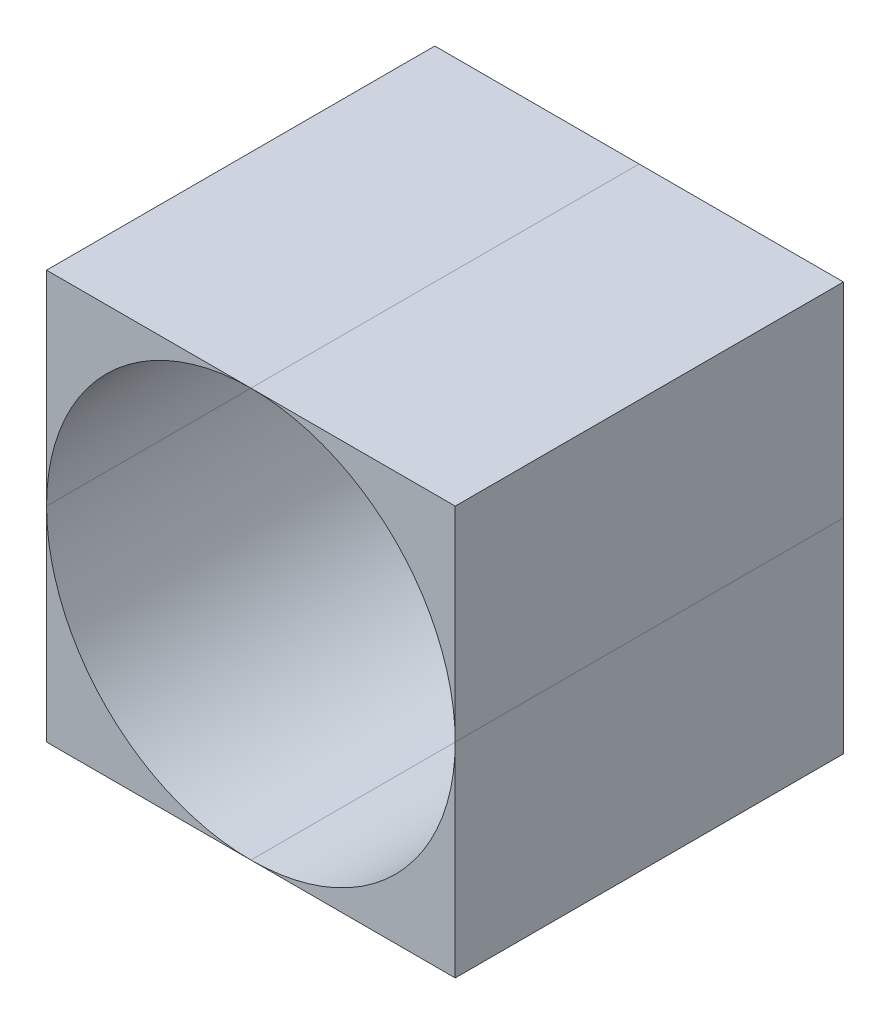
from build123d import *

# Parameters (mm, degrees)
BOSS_EXTRUDE1_DEPTH   = 9.5
BOSS_EXTRUDE1_2_DEPTH = 9.5
BOSS_EXTRUDE1_3_DEPTH = 9.5
BOSS_EXTRUDE1_4_DEPTH = 9.5


with BuildPart() as part:
    # Sketch1 → Boss-Extrude1 (new body)
    with BuildSketch(Plane.XY):
        with BuildLine():
            Line((-5, 0), (-5, -5))
            Line((-5, -5), (0, -5))
            ThreePointArc((0, -5), (-3.535533906, -3.535533906), (-5, 0))
        make_face()
    extrude(amount=BOSS_EXTRUDE1_DEPTH)


with BuildPart() as body_2:
    # Sketch1 → Boss-Extrude1 2 (new body)
    with BuildSketch(Plane.XY):
        with BuildLine():
            ThreePointArc((5, 0), (3.535533906, -3.535533906), (0, -5))
            Line((0, -5), (5, -5))
            Line((5, -5), (5, 0))
        make_face()
    extrude(amount=BOSS_EXTRUDE1_2_DEPTH)


with BuildPart() as body_3:
    # Sketch1 → Boss-Extrude1 3 (new body)
    with BuildSketch(Plane.XY):
        with BuildLine():
            Line((-5, 5), (-5, 0))
            ThreePointArc((-5, 0), (-3.535533906, 3.535533906), (0, 5))
            Line((0, 5), (-5, 5))
        make_face()
    extrude(amount=BOSS_EXTRUDE1_3_DEPTH)


with BuildPart() as body_4:
    # Sketch1 → Boss-Extrude1 4 (new body)
    with BuildSketch(Plane.XY):
        with BuildLine():
            ThreePointArc((0, 5), (3.535533906, 3.535533906), (5, 0))
            Line((5, 0), (5, 5))
            Line((5, 5), (0, 5))
        make_face()
    extrude(amount=BOSS_EXTRUDE1_4_DEPTH)


solid = Compound([part.part, body_2.part, body_3.part, body_4.part])
